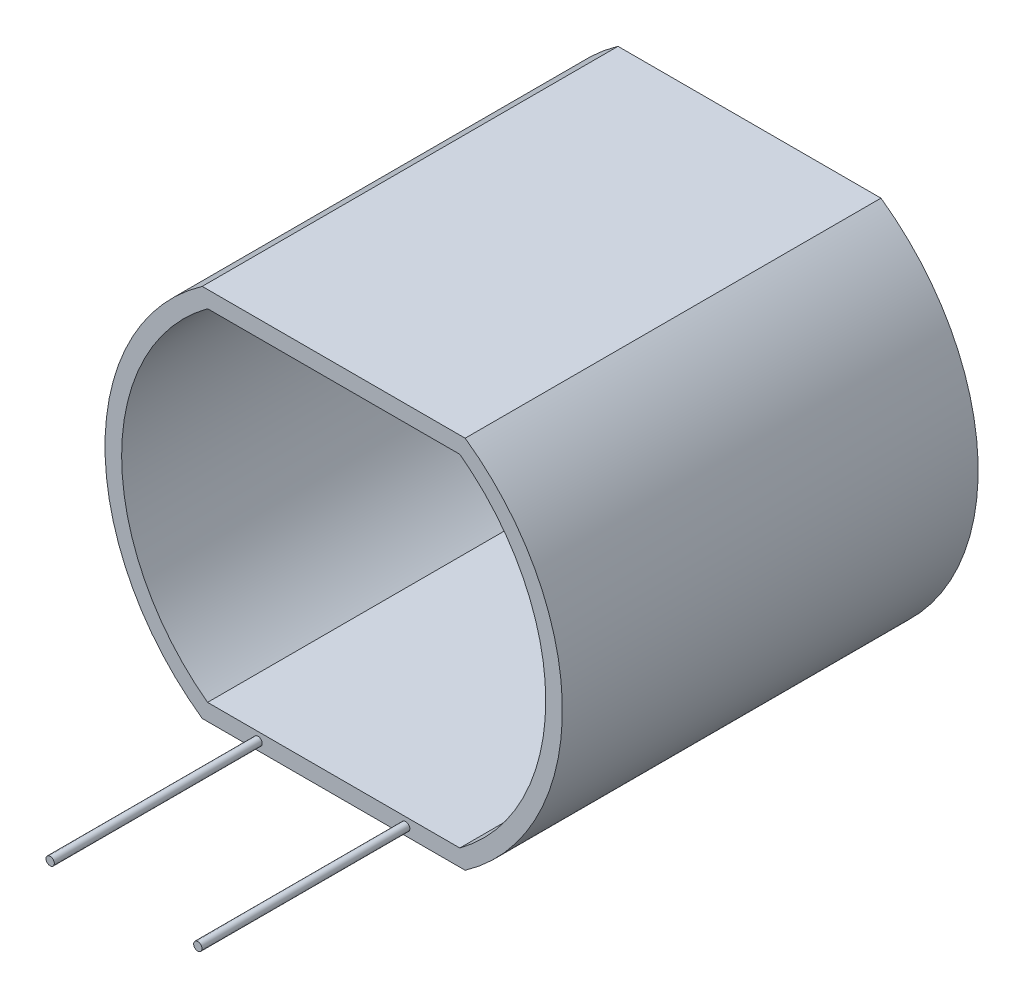
from build123d import *

# Parameters (mm, degrees)
SKETCH2_R           = 4.75
BOSS_EXTRUDE8_DEPTH = 50
SHELL4_T            = -2
SKETCH3_R           = 0.5
BOSS_EXTRUDE9_DEPTH = 25


with BuildPart() as part:
    # Sketch2 → Boss-Extrude8 (new body)
    with BuildSketch(Plane.XY):
        with BuildLine():
            Line((15.811388301, 22.5), (-15.811388301, 22.5))
            ThreePointArc((-15.811388301, 22.5), (-27.5, 0), (-15.811388301, -22.5))
            Line((-15.811388301, -22.5), (15.811388301, -22.5))
            ThreePointArc((15.811388301, -22.5), (27.5, 0), (15.811388301, 22.5))
        make_face()
        Circle(SKETCH2_R, mode=Mode.SUBTRACT)
    extrude(amount=BOSS_EXTRUDE8_DEPTH)

    # Shell4
    shell4_openings = [part.faces().sort_by_distance(p)[0] for p in [
        (-4.75, 0, 25),
        (0, -21.78936648, 50),
    ]]
    offset(amount=SHELL4_T, openings=shell4_openings, kind=Kind.INTERSECTION)

    # Sketch3 → Boss-Extrude9 (add)
    with BuildSketch(Plane.XY.offset(50)):
        with Locations((-9.096356837, -21.493666584)):
            Circle(SKETCH3_R)
        with Locations((8.657144559, -21.493666584)):
            Circle(SKETCH3_R)
    extrude(amount=BOSS_EXTRUDE9_DEPTH)


solid = part.part
